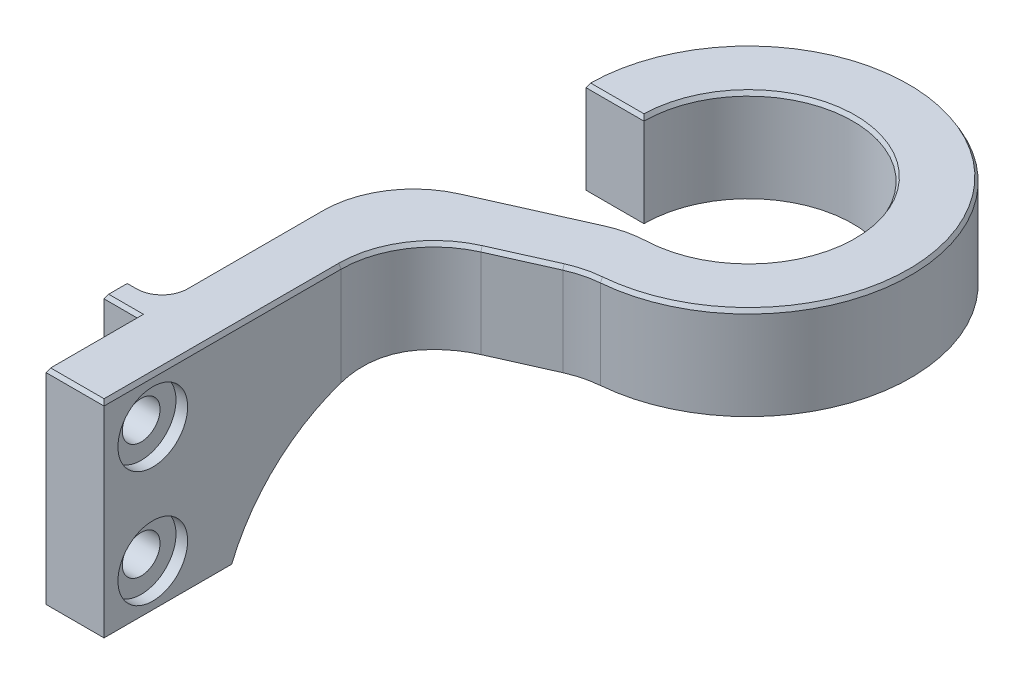
from build123d import *

# Parameters (mm, degrees)
BOSS_EXTRUDE1_DEPTH = 8
BOSS_EXTRUDE2_DEPTH = 5
FILLET1_R           = 8
SKETCH3_R           = 1.625
CUT_EXTRUDE1_DEPTH  = 52.963032648
SKETCH4_R           = 3
CUT_EXTRUDE2_DEPTH  = 1
SKETCH5_W           = 2
SKETCH5_H           = 17.649761518
BOSS_EXTRUDE3_DEPTH = 3
FILLET2_R           = 2
CHAMFER1_SIZE       = 0.2
CHAMFER1_SIZE2      = 0.346410162


with BuildPart() as part:
    # Sketch1 → Boss-Extrude1 (new body)
    with BuildSketch(Plane(origin=(0, 0, 0), x_dir=(1, 0, 0), z_dir=(0, 1, 0))):
        with BuildLine():
            Line((-16, -15.658779245), (-16, -44.520095044))
            Line((-16, -44.520095044), (-11, -44.520095044))
            Line((-11, -44.520095044), (-11, -18.904054542))
            Line((-11, -18.904054542), (0, -14))
            ThreePointArc((0, -14), (9.899494937, 9.899494937), (-14, 0))
            Line((-14, 0), (-9, 0))
            ThreePointArc((-9, 0), (6.691765492, 6.018328223), (-0.951050089, -8.949609138))
            Line((-0.951050089, -8.949609138), (-16, -15.658779245))
        make_face()
    extrude(amount=BOSS_EXTRUDE1_DEPTH)

    # Sketch2 → Boss-Extrude2 (add)
    with BuildSketch(Plane.ZY.offset(16)):
        with BuildLine():
            Line((44.520095044, 0), (44.520095044, -9.649761518))
            Line((44.520095044, -9.649761518), (33.520095044, -9.649761518))
            ThreePointArc((33.520095044, -9.649761518), (27.783236203, -2.635329296), (19.113239186, 0))
            Line((19.113239186, 0), (44.520095044, 0))
        make_face()
    extrude(amount=-BOSS_EXTRUDE2_DEPTH)

    # Fillet1
    fillet1_edges = [part.edges().sort_by_distance(p)[0] for p in [
        (0, 4, 14),
        (-11, 4, 18.904054542),
    ]]
    fillet(fillet1_edges, radius=FILLET1_R)
    fillet1_2_edges = [part.edges().sort_by_distance(p)[0] for p in [
        (-0.951050089, 4, 8.949609138),
        (-16, 4, 15.658779245),
    ]]
    fillet(fillet1_2_edges, radius=FILLET1_R)

    # Sketch3 → Cut-Extrude1 (cut, through all)
    with BuildSketch(Plane(origin=(-11, 0, 0), x_dir=(0, 0, -1), z_dir=(1, 0, 0))):
        with Locations((-40.320095044, 4)):
            Circle(SKETCH3_R)
        with Locations((-40.320095044, -6)):
            Circle(SKETCH3_R)
    extrude(amount=-CUT_EXTRUDE1_DEPTH, mode=Mode.SUBTRACT)

    # Sketch4 → Cut-Extrude2 (cut)
    with BuildSketch(Plane(origin=(-11, 0, 0), x_dir=(0, 0, -1), z_dir=(1, 0, 0))):
        with Locations((-40.320095044, 4)):
            Circle(SKETCH4_R)
        with Locations((-40.320095044, -6)):
            Circle(SKETCH4_R)
    extrude(amount=-CUT_EXTRUDE2_DEPTH, mode=Mode.SUBTRACT)

    # Sketch5 → Boss-Extrude3 (add)
    with BuildSketch(Plane.ZY.offset(16)):
        with Locations((35.520095044, -0.824880759)):
            Rectangle(SKETCH5_W, SKETCH5_H)
    extrude(amount=BOSS_EXTRUDE3_DEPTH)

    # Fillet2
    fillet2_edges = [part.edges().sort_by_distance(p)[0] for p in [
        (-16, -0.824880759, 34.520095044),
    ]]
    fillet(fillet2_edges, radius=FILLET2_R)

    # Chamfer1
    chamfer1_edges = [part.edges().sort_by_distance(p)[0] for p in [
        (-19, 8, 35.520095044),
        (-17.5, 8, 36.520095044),
        (-16, 8, 40.520095044),
        (-13.5, 8, 44.520095044),
        (-11.5, 8, 0),
        (9.46618809, 8, -10.314615022),
        (-0.11525428, 8, 14.172981147),
        (-11, 8, 34.308295031),
        (-3.815638997, 8, 15.70110016),
        (-9.710444905, 8, 19.741046801),
        (6.237696494, 8, -6.48776868),
        (-1.150763069, 8, 9.19633523),
        (-18.5, 8, 34.520095044),
        (-6.923574229, 8, 11.612298605),
        (-16.585786438, 8, 33.934308606),
        (-16, 8, 26.685657382),
        (-14.710444905, 8, 16.495771504),
    ]]
    chamfer1_side = [part.faces().sort_by_distance(p)[0] for p in [
        (-15.328166574, 8, 26.685657382),
    ]]
    chamfer(chamfer1_edges, length=CHAMFER1_SIZE, length2=CHAMFER1_SIZE2, reference=chamfer1_side[0])


solid = part.part
